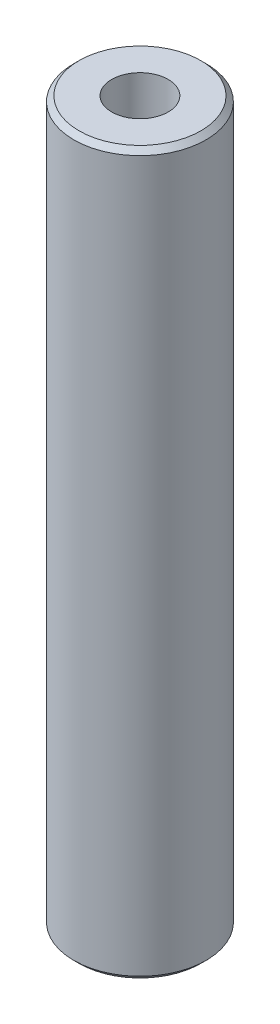
from build123d import *

# Parameters (mm, degrees)
SKETCH1_R           = 55
BOSS_EXTRUDE1_DEPTH = 600
SKETCH2_R           = 23.508018469
CUT_EXTRUDE1_DEPTH  = 606.020660804
CHAMFER1_SIZE       = 4.338560203


with BuildPart() as part:
    # Sketch1 → Boss-Extrude1 (new body)
    with BuildSketch(Plane(origin=(0, 0, 0), x_dir=(1, 0, 0), z_dir=(0, 1, 0))):
        Circle(SKETCH1_R)
    extrude(amount=BOSS_EXTRUDE1_DEPTH)

    # Sketch2 → Cut-Extrude1 (cut, through all)
    with BuildSketch(Plane(origin=(0, 0, 0), x_dir=(1, 0, 0), z_dir=(0, 1, 0))):
        Circle(SKETCH2_R)
    extrude(amount=CUT_EXTRUDE1_DEPTH, mode=Mode.SUBTRACT)

    # Chamfer1
    chamfer1_edges = [part.edges().sort_by_distance(p)[0] for p in [
        (-55, 600, 0),
        (-55, 0, 0),
    ]]
    chamfer(chamfer1_edges, length=CHAMFER1_SIZE)


solid = part.part
